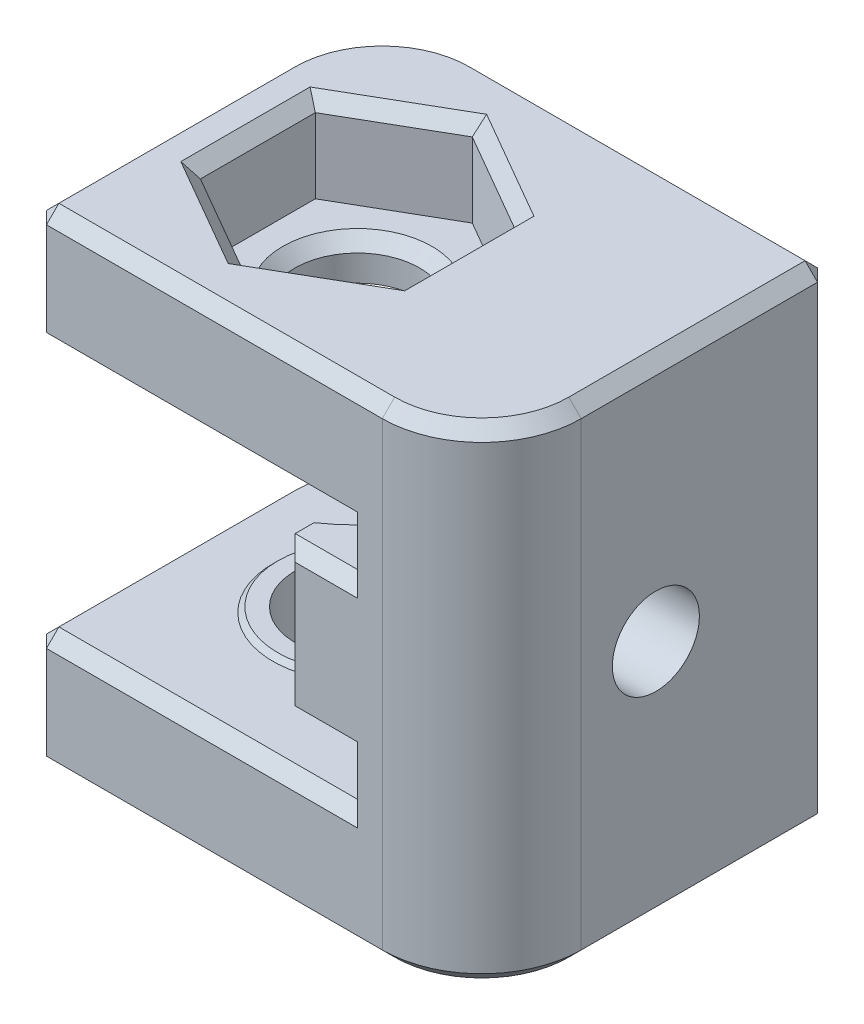
from build123d import *
from build123d.topology import SkipClean

# Parameters (mm, degrees)
BOSS_EXTRUDE1_DEPTH             = 14
SKETCH2_R                       = 2.5
CUT_EXTRUDE1_DEPTH              = 31.004166377
SKETCH3_R                       = 9.5
CUT_EXTRUDE2_DEPTH              = 2
CUT_EXTRUDE3_START              = 8
SKETCH3_2_R                     = 9.5
CUT_EXTRUDE3_DEPTH              = 2
BOSS_EXTRUDE2_REACH             = 26.8
BOSS_EXTRUDE2_DIRECTION_2_REACH = 26.8
SKETCH5_R                       = 1.75
CUT_EXTRUDE4_DEPTH              = 3.6
CUT_EXTRUDE5_DEPTH              = 3.5
SKETCH7_R                       = 4.9
CUT_EXTRUDE6_DEPTH              = 1
SKETCH9_R                       = 3.5
SKETCH9_R_2                     = 2.5
BOSS_EXTRUDE3_DEPTH             = 0.3
BOSS_EXTRUDE5_START             = 9.8
SKETCH9_2_R                     = 3.5
SKETCH9_2_R_2                   = 2.5
BOSS_EXTRUDE5_DEPTH             = 0.2
FILLET1_R                       = 4
CHAMFER1_SIZE                   = 0.5
CHAMFER2_SIZE                   = 0.3
CHAMFER3_SIZE                   = 0.5


with BuildPart() as part:
    # Sketch1 → Boss-Extrude1 (new body)
    with BuildSketch(Plane.XY):
        Polygon((0, -9.75), (18, -9.75), (18, 9.75), (0, 9.75), (0, 5), (13, 5), (13, -5), (0, -5), align=None)
    extrude(amount=BOSS_EXTRUDE1_DEPTH)

    # Sketch2 → Cut-Extrude1 (cut, through all)
    with BuildSketch(Plane(origin=(0, 9.75, 0), x_dir=(1, 0, 0), z_dir=(0, 1, 0))):
        with Locations(Location((6, -7, 0), (0, 0, 180))):
            Circle(SKETCH2_R)
    extrude(amount=-CUT_EXTRUDE1_DEPTH, mode=Mode.SUBTRACT)

    # Sketch3 → Cut-Extrude2 (cut)
    with BuildSketch(Plane(origin=(0, -5, 0), x_dir=(1, 0, 0), z_dir=(0, 1, 0))):
        with Locations((6, -7)):
            Circle(SKETCH3_R)
    extrude(amount=CUT_EXTRUDE2_DEPTH, mode=Mode.SUBTRACT)

    # Sketch3<2> → Cut-Extrude3 (cut)
    with BuildSketch(Plane(origin=(0, -5, 0), x_dir=(1, 0, 0), z_dir=(0, 1, 0)).offset(CUT_EXTRUDE3_START)):
        with Locations((6, -7)):
            Circle(SKETCH3_2_R)
    extrude(amount=CUT_EXTRUDE3_DEPTH, mode=Mode.SUBTRACT)

    # Boss-Extrude2: up to this face of the body (flat: up to its plane)
    boss_extrude2_end = Plane(part.part.faces().sort_by_distance((14.012212464, 3, 7))[0])
    # Sketch4 → Boss-Extrude2 (add, up to the picked face)
    with BuildSketch(Plane(origin=(0, 0, 0), x_dir=(1, 0, 0), z_dir=(0, 1, 0)), mode=Mode.PRIVATE) as boss_extrude2_sk1:
        with BuildLine():
            Line((10, -14), (13.722333535, -14))
            Line((13.722333535, -14), (13.722333535, 0))
            Line((13.722333535, 0), (10, 0))
            Line((10, 0), (10, -1.255437353))
            ThreePointArc((10, -1.255437353), (13, -7), (10, -12.744562647))
            Line((10, -12.744562647), (10, -14))
        make_face()
    boss_extrude2_tool1 = split(extrude(boss_extrude2_sk1.sketch, amount=BOSS_EXTRUDE2_REACH, mode=Mode.PRIVATE), bisect_by=boss_extrude2_end, keep=Keep.BOTH, mode=Mode.PRIVATE)
    add(boss_extrude2_tool1.solids().sort_by(Axis((10.144864, 0, 13.372281), (0, 1, 0)))[0])

    # Boss-Extrude2 direction 2: up to this face of the body (flat: up to its plane)
    boss_extrude2_direction_2_end = Plane(part.part.faces().sort_by_distance((14.012212464, -3, 7))[0])
    # Sketch4 → Boss-Extrude2 direction 2 (add, up to the picked face)
    with BuildSketch(Plane(origin=(0, 0, 0), x_dir=(1, 0, 0), z_dir=(0, 1, 0)), mode=Mode.PRIVATE) as boss_extrude2_direction_2_sk1:
        with BuildLine():
            Line((10, -14), (13.722333535, -14))
            Line((13.722333535, -14), (13.722333535, 0))
            Line((13.722333535, 0), (10, 0))
            Line((10, 0), (10, -1.255437353))
            ThreePointArc((10, -1.255437353), (13, -7), (10, -12.744562647))
            Line((10, -12.744562647), (10, -14))
        make_face()
    boss_extrude2_direction_2_tool1 = split(extrude(boss_extrude2_direction_2_sk1.sketch, amount=-BOSS_EXTRUDE2_DIRECTION_2_REACH, mode=Mode.PRIVATE), bisect_by=boss_extrude2_direction_2_end, keep=Keep.BOTH, mode=Mode.PRIVATE)
    add(boss_extrude2_direction_2_tool1.solids().sort_by(Axis((10.144864, 0, 13.372281), (0, -1, 0)))[0])

    # Sketch5 → Cut-Extrude4 (cut)
    with BuildSketch(Plane(origin=(18, 0, 0), x_dir=(0, 0, -1), z_dir=(1, 0, 0))):
        with Locations(Location((-7, 0, 0), (0, 0, 90))):
            Circle(SKETCH5_R)
    extrude(amount=-CUT_EXTRUDE4_DEPTH, mode=Mode.SUBTRACT)

    # Sketch6 → Cut-Extrude5 (cut)
    with BuildSketch(Plane(origin=(0, 9.75, 0), x_dir=(1, 0, 0), z_dir=(0, 1, 0))):
        Polygon((6, -2.381197846), (2, -4.690598923), (2, -9.309401077), (6, -11.618802154), (10, -9.309401077), (10, -4.690598923), align=None)
    extrude(amount=-CUT_EXTRUDE5_DEPTH, mode=Mode.SUBTRACT)

    # Sketch7 → Cut-Extrude6 (cut)
    with BuildSketch(Plane.XZ.offset(9.75)):
        with Locations(Location((6, 7, 0), (0, 0, 270))):
            Circle(SKETCH7_R)
    extrude(amount=-CUT_EXTRUDE6_DEPTH, mode=Mode.SUBTRACT)

    # Sketch9 → Boss-Extrude3 (add)
    with SkipClean():  # the faces are left unmerged after this step: merging them gives an invalid solid
        with BuildSketch(Plane.XZ.offset(-5)):
            with Locations(Location((6, 7, 0), (0, 0, 90))):
                Circle(SKETCH9_R)
            with Locations(Location((6, 7, 0), (0, 0, 270))):
                Circle(SKETCH9_R_2, mode=Mode.SUBTRACT)
        extrude(amount=BOSS_EXTRUDE3_DEPTH)

    # Sketch9<2> → Boss-Extrude5 (add)
    with SkipClean():  # the faces are left unmerged after this step: merging them gives an invalid solid
        with BuildSketch(Plane.XZ.offset(-5).offset(BOSS_EXTRUDE5_START)):
            with Locations(Location((6, 7, 0), (0, 0, 90))):
                Circle(SKETCH9_2_R)
            with Locations(Location((6, 7, 0), (0, 0, 270))):
                Circle(SKETCH9_2_R_2, mode=Mode.SUBTRACT)
        extrude(amount=BOSS_EXTRUDE5_DEPTH)

    # Fillet1
    fillet1_edges = [part.edges().sort_by_distance(p)[0] for p in [
        (0, -7.375, 0),
        (18, 0, 14),
        (0, 7.375, 0),
    ]]
    fillet(fillet1_edges, radius=FILLET1_R)

    # Chamfer1
    chamfer1_edges = [part.edges().sort_by_distance(p)[0] for p in [
        (8, 9.75, 3.535898385),
        (4, 9.75, 3.535898385),
        (2, 9.75, 7),
        (4, 9.75, 10.464101615),
        (8, 9.75, 10.464101615),
        (10, 9.75, 7),
        (6, -9.75, 11.9),
    ]]
    chamfer(chamfer1_edges, length=CHAMFER1_SIZE)

    # Chamfer2
    # the kernel refuses this chamfer: 0.3 mm, written as the material it takes off along each edge
    with BuildSketch(Plane(origin=(6, 4.7, 7), x_dir=(0, 0, 1), z_dir=(1, 0, 0))) as chamfer2_piece_1_section:
        Polygon((3.5, -CHAMFER2_SIZE), (3.5 - CHAMFER2_SIZE, 0), (3.5, 0), align=None)
    chamfer2_piece_1 = revolve(axis=Axis((6, 4.7, 7), (0, -1, 0)), mode=Mode.PRIVATE)
    chamfer2_piece_1 = split(chamfer2_piece_1, bisect_by=Plane(origin=(6, 5, 3.647041133), z_dir=(0, -1, 0)), keep=Keep.TOP, mode=Mode.PRIVATE)
    add(chamfer2_piece_1, mode=Mode.SUBTRACT)
    with BuildSketch(Plane(origin=(6, -4.8, 7), x_dir=(0, 0, 1), z_dir=(1, 0, 0))) as chamfer2_piece_2_section:
        Polygon((3.5, CHAMFER2_SIZE), (3.5 - CHAMFER2_SIZE, 0), (3.5, 0), align=None)
    chamfer2_piece_2 = revolve(axis=Axis((6, -4.8, 7), (0, -1, 0)), mode=Mode.PRIVATE)
    chamfer2_piece_2 = split(chamfer2_piece_2, bisect_by=Plane(origin=(6, -5, 3.697354153), z_dir=(0, 1, 0)), keep=Keep.TOP, mode=Mode.PRIVATE)
    add(chamfer2_piece_2, mode=Mode.SUBTRACT)

    # Chamfer3
    chamfer3_edges = [part.edges().sort_by_distance(p)[0] for p in [
        (11, 9.75, 0),
        (18, 0, 0),
        (8.5, 6.25, 7),
        (8.5, -8.75, 7),
        (0, -5, 9),
        (0, 5, 9),
        (0, 9.75, 9),
        (0, -9.75, 9),
        (11, -9.75, 0),
        (18, -9.75, 5),
        (16.828427125, -9.75, 12.828427125),
        (1.171572875, -9.75, 1.171572875),
        (8.5, 5, 0),
        (1.171572875, -5, 1.171572875),
        (1.171572875, 5, 1.171572875),
        (7, 9.75, 14),
        (18, 9.75, 5),
        (16.828427125, 9.75, 12.828427125),
        (1.171572875, 9.75, 1.171572875),
        (0, 7.375, 14),
        (6.5, 5, 14),
        (6.5, -5, 14),
        (0, -7.375, 14),
        (10, 0, 14),
        (11.5, -3, 14),
        (11.5, 3, 0),
        (11.5, 3, 14),
        (10, 0, 0),
        (11.5, -3, 0),
        (8.5, -5, 0),
        (7, -9.75, 14),
    ]]
    chamfer(chamfer3_edges, length=CHAMFER3_SIZE)


solid = part.part
